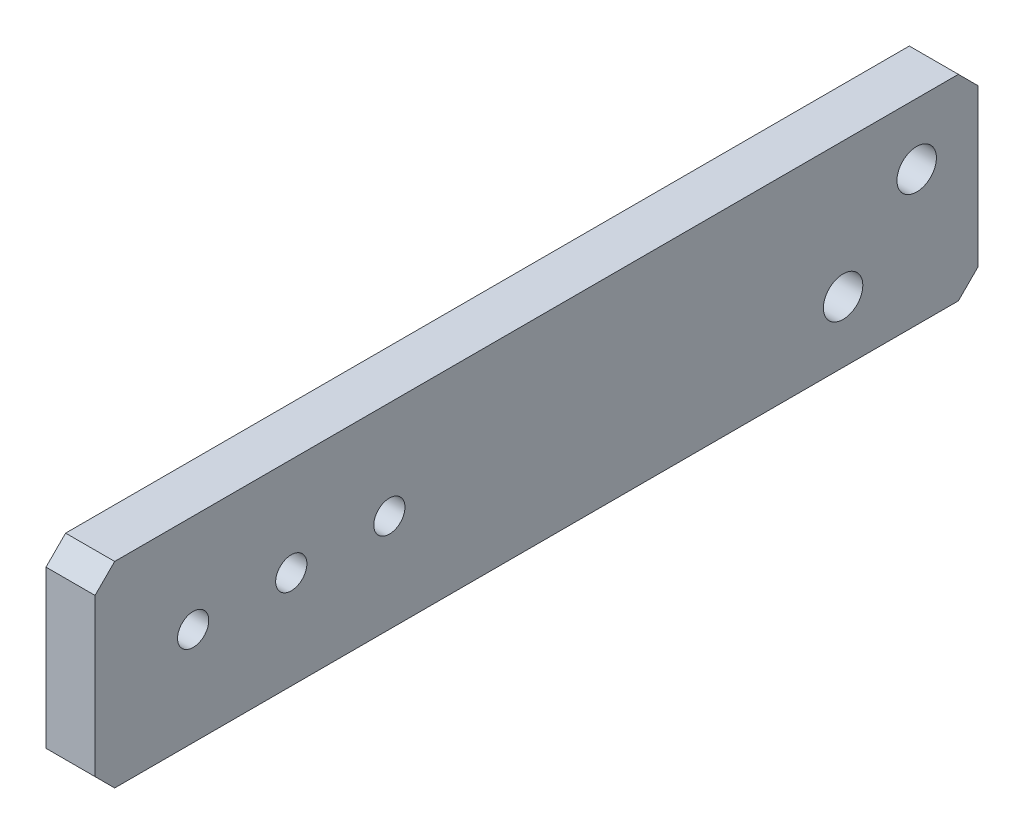
from build123d import *

# Parameters (mm, degrees)
SKETCH1_W              = 114.3
SKETCH1_H              = 25.4
BOSS_EXTRUDE1_DEPTH    = 6.35
F_10_32_TAPPED_HOLE1_D = 4.0386
F_10_CLEARANCE_HOLE1_D = 5.1054
CHAMFER1_SIZE          = 2.54


with BuildPart() as part:
    # Sketch1 → Boss-Extrude1 (new body)
    with BuildSketch(Plane(origin=(0, 0, 0), x_dir=(0, 0, -1), z_dir=(1, 0, 0))):
        with Locations((57.15, 12.7)):
            Rectangle(SKETCH1_W, SKETCH1_H)
    extrude(amount=BOSS_EXTRUDE1_DEPTH)

    # #10-32 Tapped Hole1 (through all)
    with Locations(Plane(origin=(6.35, 0, 0), x_dir=(0, 0, -1), z_dir=(1, 0, 0))):
        with Locations((12.7, 12.7), (25.4, 12.7), (38.1, 12.7)):
            Hole(F_10_32_TAPPED_HOLE1_D / 2)

    # #10 Clearance Hole1 (through all)
    with Locations(Plane(origin=(6.35, 0, 0), x_dir=(0, 0, -1), z_dir=(1, 0, 0))):
        with Locations((106.3625, 17.4625), (96.8375, 7.9375)):
            Hole(F_10_CLEARANCE_HOLE1_D / 2)

    # Chamfer1
    chamfer1_edges = [part.edges().sort_by_distance(p)[0] for p in [
        (3.175, 25.4, 0),
        (3.175, 25.4, -114.3),
        (3.175, 0, -114.3),
        (3.175, 0, 0),
    ]]
    chamfer(chamfer1_edges, length=CHAMFER1_SIZE)


solid = part.part
